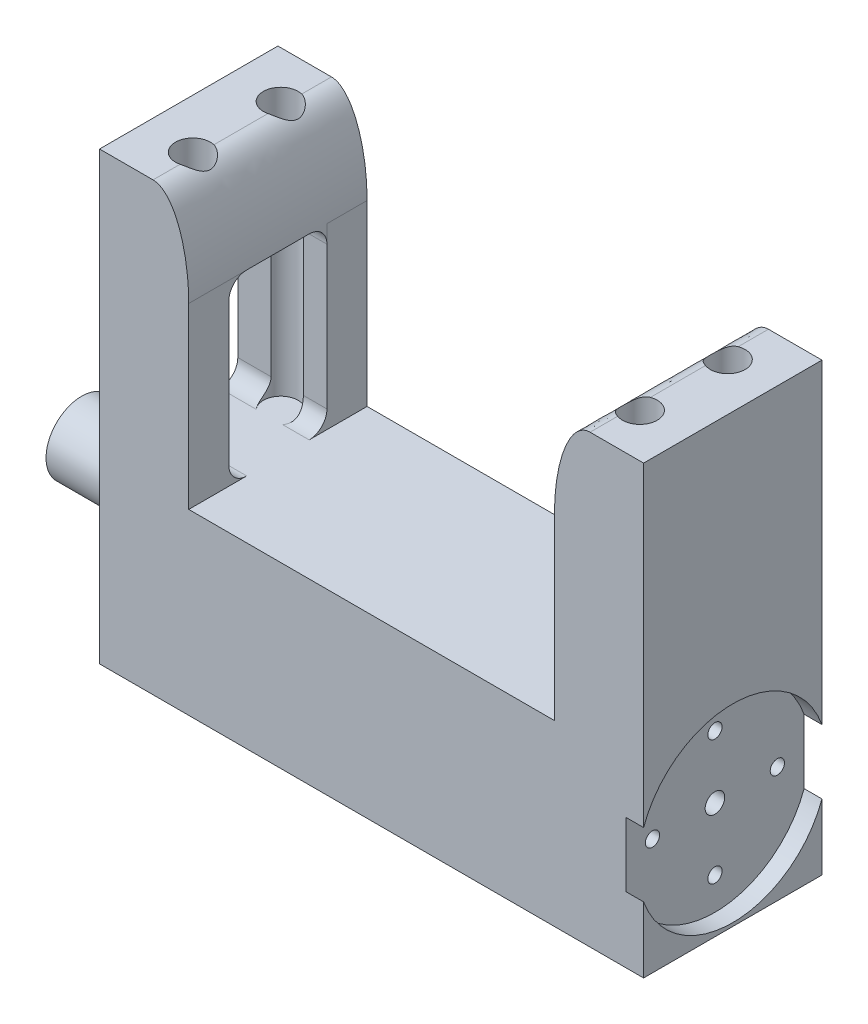
from build123d import *

# Parameters (mm, degrees)
SKIZZE1_W                       = 61
SKIZZE1_H                       = 50
AUFSATZ_LINEAR_AUSTRAGEN1_DEPTH = 20
SKIZZE2_W                       = 41
SKIZZE2_H                       = 20
SCHNITT_LINEAR_AUSTRAGEN1_DEPTH = 30
SCHNITT_LINEAR_START            = -61
SKIZZE3_W                       = 11
SKIZZE3_H                       = 20
SCHNITT_LINEAR_AUSTRAGEN2_DEPTH = 10
SCHNITT_LINEAR_AUSTRAGEN3_REACH = 83.37
SKIZZE4_R                       = 1.95
VERRUNDUNG1_SIZE                = 4
VERRUNDUNG1_SIZE_2              = 10
VERRUNDUNG2_R                   = 2
SKIZZE6_R                       = 10.631095309
SCHNITT_LINEAR_AUSTRAGEN4_DEPTH = 2
SKIZZE7_R                       = 0.8
SCHNITT_LINEAR_AUSTRAGEN5_DEPTH = 22
SKIZZE10_R                      = 1.095488433
SCHNITT_LINEAR_AUSTRAGEN6_DEPTH = 63
SKIZZE11_R                      = 4
AUFSATZ_LINEAR_AUSTRAGEN3_DEPTH = 12


with BuildPart() as part:
    # Skizze1 → Aufsatz-Linear austragen1 (new body)
    with BuildSketch(Plane.XY):
        with Locations((30.5, 25)):
            Rectangle(SKIZZE1_W, SKIZZE1_H)
    extrude(amount=AUFSATZ_LINEAR_AUSTRAGEN1_DEPTH)

    # Skizze2 → Schnitt-Linear austragen1 (cut)
    with BuildSketch(Plane(origin=(0, 50, 0), x_dir=(1, 0, 0), z_dir=(0, 1, 0))):
        with Locations((30.5, -10)):
            Rectangle(SKIZZE2_W, SKIZZE2_H)
    extrude(amount=-SCHNITT_LINEAR_AUSTRAGEN1_DEPTH, mode=Mode.SUBTRACT)

    # Skizze3 → Schnitt-Linear austragen2 (cut)
    with BuildSketch(Plane(origin=(61, 0, 0), x_dir=(0, 0, -1), z_dir=(1, 0, 0)).offset(SCHNITT_LINEAR_START)):
        with Locations((-10, 30)):
            Rectangle(SKIZZE3_W, SKIZZE3_H)
    extrude(amount=SCHNITT_LINEAR_AUSTRAGEN2_DEPTH, mode=Mode.SUBTRACT)

    # Schnitt-Linear austragen3: up to this face of the body (flat: up to its plane)
    schnitt_linear_austragen3_end = Plane(part.part.faces().sort_by_distance((27.483870968, 20, 10))[0])
    # Skizze4 → Schnitt-Linear austragen3 (cut, up to the picked face)
    with BuildSketch(Plane(origin=(0, 50, 0), x_dir=(1, 0, 0), z_dir=(0, 1, 0)), mode=Mode.PRIVATE) as schnitt_linear_austragen3_sk1:
        with Locations(Location((5.54, -5.225, 0), (0, 0, 270))):
            Circle(SKIZZE4_R)
    schnitt_linear_austragen3_tool1 = split(extrude(schnitt_linear_austragen3_sk1.sketch, amount=-SCHNITT_LINEAR_AUSTRAGEN3_REACH, mode=Mode.PRIVATE), bisect_by=schnitt_linear_austragen3_end, keep=Keep.BOTH, mode=Mode.PRIVATE)
    # Skizze4 → Schnitt-Linear austragen3 (cut, up to the picked face)
    with BuildSketch(Plane(origin=(0, 50, 0), x_dir=(1, 0, 0), z_dir=(0, 1, 0)), mode=Mode.PRIVATE) as schnitt_linear_austragen3_sk2:
        with Locations(Location((5.54, -15.075, 0), (0, 0, 270))):
            Circle(SKIZZE4_R)
    schnitt_linear_austragen3_tool2 = split(extrude(schnitt_linear_austragen3_sk2.sketch, amount=-SCHNITT_LINEAR_AUSTRAGEN3_REACH, mode=Mode.PRIVATE), bisect_by=schnitt_linear_austragen3_end, keep=Keep.BOTH, mode=Mode.PRIVATE)
    # Skizze4 → Schnitt-Linear austragen3 (cut, up to the picked face)
    with BuildSketch(Plane(origin=(0, 50, 0), x_dir=(1, 0, 0), z_dir=(0, 1, 0)), mode=Mode.PRIVATE) as schnitt_linear_austragen3_sk3:
        with Locations(Location((55.66, -15.075, 0), (0, 0, 270))):
            Circle(SKIZZE4_R)
    schnitt_linear_austragen3_tool3 = split(extrude(schnitt_linear_austragen3_sk3.sketch, amount=-SCHNITT_LINEAR_AUSTRAGEN3_REACH, mode=Mode.PRIVATE), bisect_by=schnitt_linear_austragen3_end, keep=Keep.BOTH, mode=Mode.PRIVATE)
    # Skizze4 → Schnitt-Linear austragen3 (cut, up to the picked face)
    with BuildSketch(Plane(origin=(0, 50, 0), x_dir=(1, 0, 0), z_dir=(0, 1, 0)), mode=Mode.PRIVATE) as schnitt_linear_austragen3_sk4:
        with Locations(Location((55.66, -5.225, 0), (0, 0, 270))):
            Circle(SKIZZE4_R)
    schnitt_linear_austragen3_tool4 = split(extrude(schnitt_linear_austragen3_sk4.sketch, amount=-SCHNITT_LINEAR_AUSTRAGEN3_REACH, mode=Mode.PRIVATE), bisect_by=schnitt_linear_austragen3_end, keep=Keep.BOTH, mode=Mode.PRIVATE)
    add(schnitt_linear_austragen3_tool1.solids().sort_by(Axis((5.54, 50, 5.225), (0, -1, 0)))[0], mode=Mode.SUBTRACT)
    add(schnitt_linear_austragen3_tool2.solids().sort_by(Axis((5.54, 50, 15.075), (0, -1, 0)))[0], mode=Mode.SUBTRACT)
    add(schnitt_linear_austragen3_tool3.solids().sort_by(Axis((55.66, 50, 15.075), (0, -1, 0)))[0], mode=Mode.SUBTRACT)
    add(schnitt_linear_austragen3_tool4.solids().sort_by(Axis((55.66, 50, 5.225), (0, -1, 0)))[0], mode=Mode.SUBTRACT)

    # Verrundung1
    # an asymmetric fillet: 10, 4 mm, written as the material it takes off along each edge
    with BuildSketch(Plane(origin=(51, 50, -25), x_dir=(1, 0, 0), z_dir=(0, 0, 1)), Plane(origin=(10, 50, 45), x_dir=(-1, 0, 0), z_dir=(0, 0, -1))) as verrundung1_piece_1:
        with BuildLine():
            Bezier((VERRUNDUNG1_SIZE, 0), (0, 0), (0, -VERRUNDUNG1_SIZE_2), weights=[1, 0.707106781, 1])
            Line((0, -VERRUNDUNG1_SIZE_2), (0, 0))
            Line((0, 0), (VERRUNDUNG1_SIZE, 0))
        make_face()
    extrude(amount=70, mode=Mode.SUBTRACT)

    # Verrundung2
    verrundung2_edges = [part.edges().sort_by_distance(p)[0] for p in [
        (1.818438783, 40, 15.5),
        (8.721561217, 40, 15.5),
        (8.675107038, 40, 4.5),
        (1.864892962, 40, 4.5),
        (8.721561217, 20, 15.5),
        (1.818438783, 20, 15.5),
        (8.675107038, 20, 4.5),
        (1.864892962, 20, 4.5),
    ]]
    fillet(verrundung2_edges, radius=VERRUNDUNG2_R)

    # Skizze6 → Schnitt-Linear austragen4 (cut)
    with BuildSketch(Plane(origin=(61, 0, 0), x_dir=(0, 0, -1), z_dir=(1, 0, 0))):
        with Locations((-10, 11)):
            Circle(SKIZZE6_R)
    extrude(amount=-SCHNITT_LINEAR_AUSTRAGEN4_DEPTH, mode=Mode.SUBTRACT)

    # Skizze7 → Schnitt-Linear austragen5 (cut)
    with BuildSketch(Plane(origin=(59, 0, 0), x_dir=(0, 0, -1), z_dir=(1, 0, 0))):
        with Locations(Location((-10, 18, 0), (0, 0, 90))):
            Circle(SKIZZE7_R)
        with Locations(Location((-3, 11, 0), (0, 0, 90))):
            Circle(SKIZZE7_R)
        with Locations(Location((-10, 4, 0), (0, 0, 90))):
            Circle(SKIZZE7_R)
        with Locations(Location((-17, 11, 0), (0, 0, 90))):
            Circle(SKIZZE7_R)
    extrude(amount=-SCHNITT_LINEAR_AUSTRAGEN5_DEPTH, mode=Mode.SUBTRACT)

    # Skizze10 → Schnitt-Linear austragen6 (cut)
    with BuildSketch(Plane(origin=(59, 0, 0), x_dir=(0, 0, -1), z_dir=(1, 0, 0))):
        with Locations(Location((-10, 11, 0), (0, 0, 90))):
            Circle(SKIZZE10_R)
    extrude(amount=-SCHNITT_LINEAR_AUSTRAGEN6_DEPTH, mode=Mode.SUBTRACT)

    # Skizze11 → Aufsatz-Linear austragen3 (add)
    with BuildSketch(Plane.ZY):
        with Locations(Location((10, 11, 0), (0, 0, 90))):
            Circle(SKIZZE11_R)
    extrude(amount=AUFSATZ_LINEAR_AUSTRAGEN3_DEPTH)


solid = part.part
